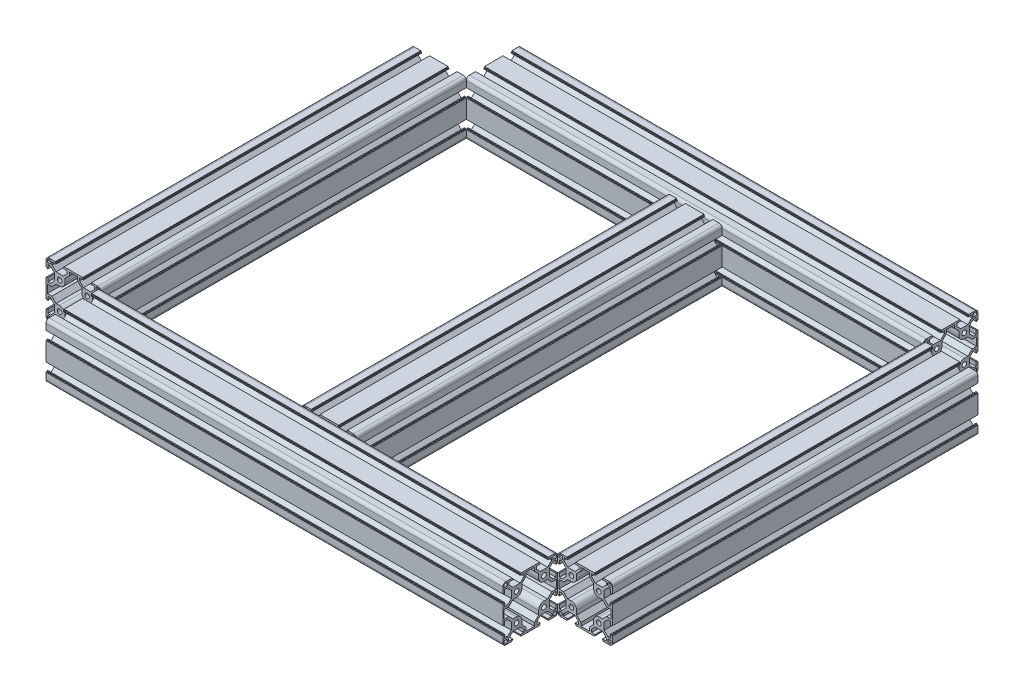
from build123d import *

# Parameters (mm, degrees)
SKETCH_110_R              = 2.55
MEMBER_6060_1_DEPTH       = 400
SKETCH_110_ON_SEGMENT_2_R = 2.55
MEMBER_6060_1_2_DEPTH     = 500
SKETCH_110_ON_SEGMENT_3_R = 2.55
MEMBER_6060_1_3_DEPTH     = 400
SKETCH_110_ON_SEGMENT_4_R = 2.55
MEMBER_6060_1_4_DEPTH     = 500
SKETCH_111_R              = 2.55
MEMBER_6060_2_DEPTH       = 400


with BuildPart() as part:
    # 草图110 → Member 6060_ _1 (new body)
    with BuildSketch(Plane(origin=(-290.754385539, 0, -90.215620869), x_dir=(1, 0, 0), z_dir=(0, 0, 1))):
        with BuildLine():
            Line((10.9, -29), (10.15, -29))
            Line((10.15, -29), (10.15, -30))
            Line((10.15, -30), (-10.15, -30))
            Line((-10.15, -30), (-10.15, -29))
            Line((-10.15, -29), (-10.9, -29))
            Line((-10.9, -29), (-10.9, -28))
            Line((-10.9, -28), (-7.1, -28))
            Line((-7.1, -28), (-7.1, -24.787919242))
            Line((-7.1, -24.787919242), (-11.047762009, -20.8125))
            Line((-11.047762009, -20.8125), (-15, -20.8125))
            Line((-15, -20.8125), (-18.952237991, -20.8125))
            Line((-18.952237991, -20.8125), (-23.6, -25.492823302))
            Line((-23.6, -25.492823302), (-23.6, -28))
            Line((-23.6, -28), (-19.1, -28))
            Line((-19.1, -28), (-19.1, -29))
            Line((-19.1, -29), (-19.85, -29))
            Line((-19.85, -29), (-19.85, -30))
            Line((-19.85, -30), (-26.625, -30))
            ThreePointArc((-26.625, -30), (-29.011485387, -29.011485387), (-30, -26.625))
            Line((-30, -26.625), (-30, -19.85))
            Line((-30, -19.85), (-29, -19.85))
            Line((-29, -19.85), (-29, -19.1))
            Line((-29, -19.1), (-28, -19.1))
            Line((-28, -19.1), (-28, -23.25))
            Line((-28, -23.25), (-25.140371272, -23.25))
            Line((-25.140371272, -23.25), (-20.8125, -18.952237991))
            Line((-20.8125, -18.952237991), (-20.8125, -15))
            Line((-20.8125, -15), (-20.8125, -11.047762009))
            Line((-20.8125, -11.047762009), (-25.140371272, -6.75))
            Line((-25.140371272, -6.75), (-28, -6.75))
            Line((-28, -6.75), (-28, -10.9))
            Line((-28, -10.9), (-29, -10.9))
            Line((-29, -10.9), (-29, -10.15))
            Line((-29, -10.15), (-30, -10.15))
            Line((-30, -10.15), (-30, 10.15))
            Line((-30, 10.15), (-29, 10.15))
            Line((-29, 10.15), (-29, 10.9))
            Line((-29, 10.9), (-28, 10.9))
            Line((-28, 10.9), (-28, 6.75))
            Line((-28, 6.75), (-25.140371272, 6.75))
            Line((-25.140371272, 6.75), (-20.8125, 11.047762009))
            Line((-20.8125, 11.047762009), (-20.8125, 15))
            Line((-20.8125, 15), (-20.8125, 18.952237991))
            Line((-20.8125, 18.952237991), (-25.140371272, 23.25))
            Line((-25.140371272, 23.25), (-28, 23.25))
            Line((-28, 23.25), (-28, 19.1))
            Line((-28, 19.1), (-29, 19.1))
            Line((-29, 19.1), (-29, 19.85))
            Line((-29, 19.85), (-30, 19.85))
            Line((-30, 19.85), (-30, 26.625))
            ThreePointArc((-30, 26.625), (-29.011485387, 29.011485387), (-26.625, 30))
            Line((-26.625, 30), (-19.85, 30))
            Line((-19.85, 30), (-19.85, 29))
            Line((-19.85, 29), (-19.1, 29))
            Line((-19.1, 29), (-19.1, 28))
            Line((-19.1, 28), (-23.25, 28))
            Line((-23.25, 28), (-23.25, 25.140371272))
            Line((-23.25, 25.140371272), (-18.952237991, 20.8125))
            Line((-18.952237991, 20.8125), (-15, 20.8125))
            Line((-15, 20.8125), (-11.047762009, 20.8125))
            Line((-11.047762009, 20.8125), (-6.75, 25.140371272))
            Line((-6.75, 25.140371272), (-6.75, 28))
            Line((-6.75, 28), (-10.9, 28))
            Line((-10.9, 28), (-10.9, 29))
            Line((-10.9, 29), (-10.15, 29))
            Line((-10.15, 29), (-10.15, 30))
            Line((-10.15, 30), (10.15, 30))
            Line((10.15, 30), (10.15, 29))
            Line((10.15, 29), (10.9, 29))
            Line((10.9, 29), (10.9, 28))
            Line((10.9, 28), (6.75, 28))
            Line((6.75, 28), (6.75, 25.140371272))
            Line((6.75, 25.140371272), (11.047762009, 20.8125))
            Line((11.047762009, 20.8125), (15, 20.8125))
            Line((15, 20.8125), (18.952237991, 20.8125))
            Line((18.952237991, 20.8125), (23.25, 25.140371272))
            Line((23.25, 25.140371272), (23.25, 28))
            Line((23.25, 28), (19.1, 28))
            Line((19.1, 28), (19.1, 29))
            Line((19.1, 29), (19.85, 29))
            Line((19.85, 29), (19.85, 30))
            Line((19.85, 30), (26.625, 30))
            ThreePointArc((26.625, 30), (29.011485387, 29.011485387), (30, 26.625))
            Line((30, 26.625), (30, 19.85))
            Line((30, 19.85), (29, 19.85))
            Line((29, 19.85), (29, 19.1))
            Line((29, 19.1), (28, 19.1))
            Line((28, 19.1), (28, 23.25))
            Line((28, 23.25), (25.140371272, 23.25))
            Line((25.140371272, 23.25), (20.8125, 18.952237991))
            Line((20.8125, 18.952237991), (20.8125, 15))
            Line((20.8125, 15), (20.8125, 11.047762009))
            Line((20.8125, 11.047762009), (25.140371272, 6.75))
            Line((25.140371272, 6.75), (28, 6.75))
            Line((28, 6.75), (28, 10.9))
            Line((28, 10.9), (29, 10.9))
            Line((29, 10.9), (29, 10.15))
            Line((29, 10.15), (30, 10.15))
            Line((30, 10.15), (30, -10.15))
            Line((30, -10.15), (29, -10.15))
            Line((29, -10.15), (29, -10.9))
            Line((29, -10.9), (28, -10.9))
            Line((28, -10.9), (28, -6.75))
            Line((28, -6.75), (25.140371272, -6.75))
            Line((25.140371272, -6.75), (20.8125, -11.047762009))
            Line((20.8125, -11.047762009), (20.8125, -15))
            Line((20.8125, -15), (20.8125, -18.952237991))
            Line((20.8125, -18.952237991), (25.140371272, -23.25))
            Line((25.140371272, -23.25), (28, -23.25))
            Line((28, -23.25), (28, -19.1))
            Line((28, -19.1), (29, -19.1))
            Line((29, -19.1), (29, -19.85))
            Line((29, -19.85), (30, -19.85))
            Line((30, -19.85), (30, -26.625))
            ThreePointArc((30, -26.625), (29.011485387, -29.011485387), (26.625, -30))
            Line((26.625, -30), (19.85, -30))
            Line((19.85, -30), (19.85, -29))
            Line((19.85, -29), (19.1, -29))
            Line((19.1, -29), (19.1, -28))
            Line((19.1, -28), (23.6, -28))
            Line((23.6, -28), (23.6, -25.492823302))
            Line((23.6, -25.492823302), (18.952237991, -20.8125))
            Line((18.952237991, -20.8125), (15, -20.8125))
            Line((15, -20.8125), (11.047762009, -20.8125))
            Line((11.047762009, -20.8125), (7.1, -24.787919242))
            Line((7.1, -24.787919242), (7.1, -28))
            Line((7.1, -28), (10.9, -28))
            Line((10.9, -28), (10.9, -29))
        make_face()
        with Locations((-15, 15)):
            Circle(SKETCH_110_R, mode=Mode.SUBTRACT)
        with Locations((-15, -15)):
            Circle(SKETCH_110_R, mode=Mode.SUBTRACT)
        with Locations((15, 15)):
            Circle(SKETCH_110_R, mode=Mode.SUBTRACT)
        with Locations((15, -15)):
            Circle(SKETCH_110_R, mode=Mode.SUBTRACT)
        with BuildLine():
            Line((-9.1875, 15.1875), (-9.1875, 19.563607307))
            Line((-9.1875, 19.563607307), (-4.55, 24.233596706))
            Line((-4.55, 24.233596706), (-4.55, 28))
            Line((-4.55, 28), (4.55, 28))
            Line((4.55, 28), (4.55, 24.233596706))
            Line((4.55, 24.233596706), (9.1875, 19.563607307))
            Line((9.1875, 19.563607307), (9.1875, 15.1875))
            ThreePointArc((9.1875, 15.1875), (10.944859313, 10.944859313), (15.1875, 9.1875))
            Line((15.1875, 9.1875), (18.952237991, 9.1875))
            Line((18.952237991, 9.1875), (23.557474622, 4.55))
            Line((23.557474622, 4.55), (28.5, 4.55))
            Line((28.5, 4.55), (28.5, -4.55))
            Line((28.5, -4.55), (23.557474622, -4.55))
            Line((23.557474622, -4.55), (18.952237991, -9.1875))
            Line((18.952237991, -9.1875), (15.1875, -9.1875))
            ThreePointArc((15.1875, -9.1875), (10.944859313, -10.944859313), (9.1875, -15.1875))
            Line((9.1875, -15.1875), (9.1875, -19.563607307))
            Line((9.1875, -19.563607307), (4.55, -24.233596706))
            Line((4.55, -24.233596706), (4.55, -28))
            Line((4.55, -28), (-4.55, -28))
            Line((-4.55, -28), (-4.55, -24.233596706))
            Line((-4.55, -24.233596706), (-9.1875, -19.563607307))
            Line((-9.1875, -19.563607307), (-9.1875, -15.1875))
            ThreePointArc((-9.1875, -15.1875), (-10.944859313, -10.944859313), (-15.1875, -9.1875))
            Line((-15.1875, -9.1875), (-18.952237991, -9.1875))
            Line((-18.952237991, -9.1875), (-23.557474622, -4.55))
            Line((-23.557474622, -4.55), (-28.5, -4.55))
            Line((-28.5, -4.55), (-28.5, 4.55))
            Line((-28.5, 4.55), (-23.557474622, 4.55))
            Line((-23.557474622, 4.55), (-18.952237991, 9.1875))
            Line((-18.952237991, 9.1875), (-15.1875, 9.1875))
            ThreePointArc((-15.1875, 9.1875), (-10.944859313, 10.944859313), (-9.1875, 15.1875))
        make_face(mode=Mode.SUBTRACT)
        with BuildLine():
            Line((-25.75, 28.6), (-27.6, 28.6))
            ThreePointArc((-27.6, 28.6), (-28.307106781, 28.307106781), (-28.6, 27.6))
            Line((-28.6, 27.6), (-28.6, 26))
            ThreePointArc((-28.6, 26), (-28.307106781, 25.292893219), (-27.6, 25))
            Line((-27.6, 25), (-25.75, 25))
            ThreePointArc((-25.75, 25), (-25.042893219, 25.292893219), (-24.75, 26))
            Line((-24.75, 26), (-24.75, 27.6))
            ThreePointArc((-24.75, 27.6), (-25.042893219, 28.307106781), (-25.75, 28.6))
        make_face(mode=Mode.SUBTRACT)
        with BuildLine():
            Line((-26, -28.6), (-27.6, -28.6))
            ThreePointArc((-27.6, -28.6), (-28.307106781, -28.307106781), (-28.6, -27.6))
            Line((-28.6, -27.6), (-28.6, -26))
            ThreePointArc((-28.6, -26), (-28.307106781, -25.292893219), (-27.6, -25))
            Line((-27.6, -25), (-26, -25))
            ThreePointArc((-26, -25), (-25.292893219, -25.292893219), (-25, -26))
            Line((-25, -26), (-25, -27.6))
            ThreePointArc((-25, -27.6), (-25.292893219, -28.307106781), (-26, -28.6))
        make_face(mode=Mode.SUBTRACT)
        with BuildLine():
            Line((26, -28.6), (27.6, -28.6))
            ThreePointArc((27.6, -28.6), (28.307106781, -28.307106781), (28.6, -27.6))
            Line((28.6, -27.6), (28.6, -26))
            ThreePointArc((28.6, -26), (28.307106781, -25.292893219), (27.6, -25))
            Line((27.6, -25), (26, -25))
            ThreePointArc((26, -25), (25.292893219, -25.292893219), (25, -26))
            Line((25, -26), (25, -27.6))
            ThreePointArc((25, -27.6), (25.292893219, -28.307106781), (26, -28.6))
        make_face(mode=Mode.SUBTRACT)
        with BuildLine():
            Line((25.75, 28.6), (27.6, 28.6))
            ThreePointArc((27.6, 28.6), (28.307106781, 28.307106781), (28.6, 27.6))
            Line((28.6, 27.6), (28.6, 26))
            ThreePointArc((28.6, 26), (28.307106781, 25.292893219), (27.6, 25))
            Line((27.6, 25), (25.75, 25))
            ThreePointArc((25.75, 25), (25.042893219, 25.292893219), (24.75, 26))
            Line((24.75, 26), (24.75, 27.6))
            ThreePointArc((24.75, 27.6), (25.042893219, 28.307106781), (25.75, 28.6))
        make_face(mode=Mode.SUBTRACT)
    extrude(amount=MEMBER_6060_1_DEPTH)


with BuildPart() as body_2:
    # 草图110 on segment 2 (carried to segment 2) → Member 6060_ _1 2 (new body)
    with BuildSketch(Plane(origin=(-260.754385539, 0, 339.784379131), x_dir=(0, 0, -1), z_dir=(1, 0, 0))):
        with BuildLine():
            Line((10.9, -29), (10.15, -29))
            Line((10.15, -29), (10.15, -30))
            Line((10.15, -30), (-10.15, -30))
            Line((-10.15, -30), (-10.15, -29))
            Line((-10.15, -29), (-10.9, -29))
            Line((-10.9, -29), (-10.9, -28))
            Line((-10.9, -28), (-7.1, -28))
            Line((-7.1, -28), (-7.1, -24.787919242))
            Line((-7.1, -24.787919242), (-11.047762009, -20.8125))
            Line((-11.047762009, -20.8125), (-15, -20.8125))
            Line((-15, -20.8125), (-18.952237991, -20.8125))
            Line((-18.952237991, -20.8125), (-23.6, -25.492823302))
            Line((-23.6, -25.492823302), (-23.6, -28))
            Line((-23.6, -28), (-19.1, -28))
            Line((-19.1, -28), (-19.1, -29))
            Line((-19.1, -29), (-19.85, -29))
            Line((-19.85, -29), (-19.85, -30))
            Line((-19.85, -30), (-26.625, -30))
            ThreePointArc((-26.625, -30), (-29.011485387, -29.011485387), (-30, -26.625))
            Line((-30, -26.625), (-30, -19.85))
            Line((-30, -19.85), (-29, -19.85))
            Line((-29, -19.85), (-29, -19.1))
            Line((-29, -19.1), (-28, -19.1))
            Line((-28, -19.1), (-28, -23.25))
            Line((-28, -23.25), (-25.140371272, -23.25))
            Line((-25.140371272, -23.25), (-20.8125, -18.952237991))
            Line((-20.8125, -18.952237991), (-20.8125, -15))
            Line((-20.8125, -15), (-20.8125, -11.047762009))
            Line((-20.8125, -11.047762009), (-25.140371272, -6.75))
            Line((-25.140371272, -6.75), (-28, -6.75))
            Line((-28, -6.75), (-28, -10.9))
            Line((-28, -10.9), (-29, -10.9))
            Line((-29, -10.9), (-29, -10.15))
            Line((-29, -10.15), (-30, -10.15))
            Line((-30, -10.15), (-30, 10.15))
            Line((-30, 10.15), (-29, 10.15))
            Line((-29, 10.15), (-29, 10.9))
            Line((-29, 10.9), (-28, 10.9))
            Line((-28, 10.9), (-28, 6.75))
            Line((-28, 6.75), (-25.140371272, 6.75))
            Line((-25.140371272, 6.75), (-20.8125, 11.047762009))
            Line((-20.8125, 11.047762009), (-20.8125, 15))
            Line((-20.8125, 15), (-20.8125, 18.952237991))
            Line((-20.8125, 18.952237991), (-25.140371272, 23.25))
            Line((-25.140371272, 23.25), (-28, 23.25))
            Line((-28, 23.25), (-28, 19.1))
            Line((-28, 19.1), (-29, 19.1))
            Line((-29, 19.1), (-29, 19.85))
            Line((-29, 19.85), (-30, 19.85))
            Line((-30, 19.85), (-30, 26.625))
            ThreePointArc((-30, 26.625), (-29.011485387, 29.011485387), (-26.625, 30))
            Line((-26.625, 30), (-19.85, 30))
            Line((-19.85, 30), (-19.85, 29))
            Line((-19.85, 29), (-19.1, 29))
            Line((-19.1, 29), (-19.1, 28))
            Line((-19.1, 28), (-23.25, 28))
            Line((-23.25, 28), (-23.25, 25.140371272))
            Line((-23.25, 25.140371272), (-18.952237991, 20.8125))
            Line((-18.952237991, 20.8125), (-15, 20.8125))
            Line((-15, 20.8125), (-11.047762009, 20.8125))
            Line((-11.047762009, 20.8125), (-6.75, 25.140371272))
            Line((-6.75, 25.140371272), (-6.75, 28))
            Line((-6.75, 28), (-10.9, 28))
            Line((-10.9, 28), (-10.9, 29))
            Line((-10.9, 29), (-10.15, 29))
            Line((-10.15, 29), (-10.15, 30))
            Line((-10.15, 30), (10.15, 30))
            Line((10.15, 30), (10.15, 29))
            Line((10.15, 29), (10.9, 29))
            Line((10.9, 29), (10.9, 28))
            Line((10.9, 28), (6.75, 28))
            Line((6.75, 28), (6.75, 25.140371272))
            Line((6.75, 25.140371272), (11.047762009, 20.8125))
            Line((11.047762009, 20.8125), (15, 20.8125))
            Line((15, 20.8125), (18.952237991, 20.8125))
            Line((18.952237991, 20.8125), (23.25, 25.140371272))
            Line((23.25, 25.140371272), (23.25, 28))
            Line((23.25, 28), (19.1, 28))
            Line((19.1, 28), (19.1, 29))
            Line((19.1, 29), (19.85, 29))
            Line((19.85, 29), (19.85, 30))
            Line((19.85, 30), (26.625, 30))
            ThreePointArc((26.625, 30), (29.011485387, 29.011485387), (30, 26.625))
            Line((30, 26.625), (30, 19.85))
            Line((30, 19.85), (29, 19.85))
            Line((29, 19.85), (29, 19.1))
            Line((29, 19.1), (28, 19.1))
            Line((28, 19.1), (28, 23.25))
            Line((28, 23.25), (25.140371272, 23.25))
            Line((25.140371272, 23.25), (20.8125, 18.952237991))
            Line((20.8125, 18.952237991), (20.8125, 15))
            Line((20.8125, 15), (20.8125, 11.047762009))
            Line((20.8125, 11.047762009), (25.140371272, 6.75))
            Line((25.140371272, 6.75), (28, 6.75))
            Line((28, 6.75), (28, 10.9))
            Line((28, 10.9), (29, 10.9))
            Line((29, 10.9), (29, 10.15))
            Line((29, 10.15), (30, 10.15))
            Line((30, 10.15), (30, -10.15))
            Line((30, -10.15), (29, -10.15))
            Line((29, -10.15), (29, -10.9))
            Line((29, -10.9), (28, -10.9))
            Line((28, -10.9), (28, -6.75))
            Line((28, -6.75), (25.140371272, -6.75))
            Line((25.140371272, -6.75), (20.8125, -11.047762009))
            Line((20.8125, -11.047762009), (20.8125, -15))
            Line((20.8125, -15), (20.8125, -18.952237991))
            Line((20.8125, -18.952237991), (25.140371272, -23.25))
            Line((25.140371272, -23.25), (28, -23.25))
            Line((28, -23.25), (28, -19.1))
            Line((28, -19.1), (29, -19.1))
            Line((29, -19.1), (29, -19.85))
            Line((29, -19.85), (30, -19.85))
            Line((30, -19.85), (30, -26.625))
            ThreePointArc((30, -26.625), (29.011485387, -29.011485387), (26.625, -30))
            Line((26.625, -30), (19.85, -30))
            Line((19.85, -30), (19.85, -29))
            Line((19.85, -29), (19.1, -29))
            Line((19.1, -29), (19.1, -28))
            Line((19.1, -28), (23.6, -28))
            Line((23.6, -28), (23.6, -25.492823302))
            Line((23.6, -25.492823302), (18.952237991, -20.8125))
            Line((18.952237991, -20.8125), (15, -20.8125))
            Line((15, -20.8125), (11.047762009, -20.8125))
            Line((11.047762009, -20.8125), (7.1, -24.787919242))
            Line((7.1, -24.787919242), (7.1, -28))
            Line((7.1, -28), (10.9, -28))
            Line((10.9, -28), (10.9, -29))
        make_face()
        with Locations((-15, 15)):
            Circle(SKETCH_110_ON_SEGMENT_2_R, mode=Mode.SUBTRACT)
        with Locations((-15, -15)):
            Circle(SKETCH_110_ON_SEGMENT_2_R, mode=Mode.SUBTRACT)
        with Locations((15, 15)):
            Circle(SKETCH_110_ON_SEGMENT_2_R, mode=Mode.SUBTRACT)
        with Locations((15, -15)):
            Circle(SKETCH_110_ON_SEGMENT_2_R, mode=Mode.SUBTRACT)
        with BuildLine():
            Line((-9.1875, 15.1875), (-9.1875, 19.563607307))
            Line((-9.1875, 19.563607307), (-4.55, 24.233596706))
            Line((-4.55, 24.233596706), (-4.55, 28))
            Line((-4.55, 28), (4.55, 28))
            Line((4.55, 28), (4.55, 24.233596706))
            Line((4.55, 24.233596706), (9.1875, 19.563607307))
            Line((9.1875, 19.563607307), (9.1875, 15.1875))
            ThreePointArc((9.1875, 15.1875), (10.944859313, 10.944859313), (15.1875, 9.1875))
            Line((15.1875, 9.1875), (18.952237991, 9.1875))
            Line((18.952237991, 9.1875), (23.557474622, 4.55))
            Line((23.557474622, 4.55), (28.5, 4.55))
            Line((28.5, 4.55), (28.5, -4.55))
            Line((28.5, -4.55), (23.557474622, -4.55))
            Line((23.557474622, -4.55), (18.952237991, -9.1875))
            Line((18.952237991, -9.1875), (15.1875, -9.1875))
            ThreePointArc((15.1875, -9.1875), (10.944859313, -10.944859313), (9.1875, -15.1875))
            Line((9.1875, -15.1875), (9.1875, -19.563607307))
            Line((9.1875, -19.563607307), (4.55, -24.233596706))
            Line((4.55, -24.233596706), (4.55, -28))
            Line((4.55, -28), (-4.55, -28))
            Line((-4.55, -28), (-4.55, -24.233596706))
            Line((-4.55, -24.233596706), (-9.1875, -19.563607307))
            Line((-9.1875, -19.563607307), (-9.1875, -15.1875))
            ThreePointArc((-9.1875, -15.1875), (-10.944859313, -10.944859313), (-15.1875, -9.1875))
            Line((-15.1875, -9.1875), (-18.952237991, -9.1875))
            Line((-18.952237991, -9.1875), (-23.557474622, -4.55))
            Line((-23.557474622, -4.55), (-28.5, -4.55))
            Line((-28.5, -4.55), (-28.5, 4.55))
            Line((-28.5, 4.55), (-23.557474622, 4.55))
            Line((-23.557474622, 4.55), (-18.952237991, 9.1875))
            Line((-18.952237991, 9.1875), (-15.1875, 9.1875))
            ThreePointArc((-15.1875, 9.1875), (-10.944859313, 10.944859313), (-9.1875, 15.1875))
        make_face(mode=Mode.SUBTRACT)
        with BuildLine():
            Line((-25.75, 28.6), (-27.6, 28.6))
            ThreePointArc((-27.6, 28.6), (-28.307106781, 28.307106781), (-28.6, 27.6))
            Line((-28.6, 27.6), (-28.6, 26))
            ThreePointArc((-28.6, 26), (-28.307106781, 25.292893219), (-27.6, 25))
            Line((-27.6, 25), (-25.75, 25))
            ThreePointArc((-25.75, 25), (-25.042893219, 25.292893219), (-24.75, 26))
            Line((-24.75, 26), (-24.75, 27.6))
            ThreePointArc((-24.75, 27.6), (-25.042893219, 28.307106781), (-25.75, 28.6))
        make_face(mode=Mode.SUBTRACT)
        with BuildLine():
            Line((-26, -28.6), (-27.6, -28.6))
            ThreePointArc((-27.6, -28.6), (-28.307106781, -28.307106781), (-28.6, -27.6))
            Line((-28.6, -27.6), (-28.6, -26))
            ThreePointArc((-28.6, -26), (-28.307106781, -25.292893219), (-27.6, -25))
            Line((-27.6, -25), (-26, -25))
            ThreePointArc((-26, -25), (-25.292893219, -25.292893219), (-25, -26))
            Line((-25, -26), (-25, -27.6))
            ThreePointArc((-25, -27.6), (-25.292893219, -28.307106781), (-26, -28.6))
        make_face(mode=Mode.SUBTRACT)
        with BuildLine():
            Line((26, -28.6), (27.6, -28.6))
            ThreePointArc((27.6, -28.6), (28.307106781, -28.307106781), (28.6, -27.6))
            Line((28.6, -27.6), (28.6, -26))
            ThreePointArc((28.6, -26), (28.307106781, -25.292893219), (27.6, -25))
            Line((27.6, -25), (26, -25))
            ThreePointArc((26, -25), (25.292893219, -25.292893219), (25, -26))
            Line((25, -26), (25, -27.6))
            ThreePointArc((25, -27.6), (25.292893219, -28.307106781), (26, -28.6))
        make_face(mode=Mode.SUBTRACT)
        with BuildLine():
            Line((25.75, 28.6), (27.6, 28.6))
            ThreePointArc((27.6, 28.6), (28.307106781, 28.307106781), (28.6, 27.6))
            Line((28.6, 27.6), (28.6, 26))
            ThreePointArc((28.6, 26), (28.307106781, 25.292893219), (27.6, 25))
            Line((27.6, 25), (25.75, 25))
            ThreePointArc((25.75, 25), (25.042893219, 25.292893219), (24.75, 26))
            Line((24.75, 26), (24.75, 27.6))
            ThreePointArc((24.75, 27.6), (25.042893219, 28.307106781), (25.75, 28.6))
        make_face(mode=Mode.SUBTRACT)
    extrude(amount=MEMBER_6060_1_2_DEPTH)


with BuildPart() as body_3:
    # 草图110 on segment 3 (carried to segment 3) → Member 6060_ _1 3 (new body)
    with BuildSketch(Plane(origin=(269.245614461, 0, -90.215620869), x_dir=(1, 0, 0), z_dir=(0, 0, 1))):
        with BuildLine():
            Line((10.9, -29), (10.15, -29))
            Line((10.15, -29), (10.15, -30))
            Line((10.15, -30), (-10.15, -30))
            Line((-10.15, -30), (-10.15, -29))
            Line((-10.15, -29), (-10.9, -29))
            Line((-10.9, -29), (-10.9, -28))
            Line((-10.9, -28), (-7.1, -28))
            Line((-7.1, -28), (-7.1, -24.787919242))
            Line((-7.1, -24.787919242), (-11.047762009, -20.8125))
            Line((-11.047762009, -20.8125), (-15, -20.8125))
            Line((-15, -20.8125), (-18.952237991, -20.8125))
            Line((-18.952237991, -20.8125), (-23.6, -25.492823302))
            Line((-23.6, -25.492823302), (-23.6, -28))
            Line((-23.6, -28), (-19.1, -28))
            Line((-19.1, -28), (-19.1, -29))
            Line((-19.1, -29), (-19.85, -29))
            Line((-19.85, -29), (-19.85, -30))
            Line((-19.85, -30), (-26.625, -30))
            ThreePointArc((-26.625, -30), (-29.011485387, -29.011485387), (-30, -26.625))
            Line((-30, -26.625), (-30, -19.85))
            Line((-30, -19.85), (-29, -19.85))
            Line((-29, -19.85), (-29, -19.1))
            Line((-29, -19.1), (-28, -19.1))
            Line((-28, -19.1), (-28, -23.25))
            Line((-28, -23.25), (-25.140371272, -23.25))
            Line((-25.140371272, -23.25), (-20.8125, -18.952237991))
            Line((-20.8125, -18.952237991), (-20.8125, -15))
            Line((-20.8125, -15), (-20.8125, -11.047762009))
            Line((-20.8125, -11.047762009), (-25.140371272, -6.75))
            Line((-25.140371272, -6.75), (-28, -6.75))
            Line((-28, -6.75), (-28, -10.9))
            Line((-28, -10.9), (-29, -10.9))
            Line((-29, -10.9), (-29, -10.15))
            Line((-29, -10.15), (-30, -10.15))
            Line((-30, -10.15), (-30, 10.15))
            Line((-30, 10.15), (-29, 10.15))
            Line((-29, 10.15), (-29, 10.9))
            Line((-29, 10.9), (-28, 10.9))
            Line((-28, 10.9), (-28, 6.75))
            Line((-28, 6.75), (-25.140371272, 6.75))
            Line((-25.140371272, 6.75), (-20.8125, 11.047762009))
            Line((-20.8125, 11.047762009), (-20.8125, 15))
            Line((-20.8125, 15), (-20.8125, 18.952237991))
            Line((-20.8125, 18.952237991), (-25.140371272, 23.25))
            Line((-25.140371272, 23.25), (-28, 23.25))
            Line((-28, 23.25), (-28, 19.1))
            Line((-28, 19.1), (-29, 19.1))
            Line((-29, 19.1), (-29, 19.85))
            Line((-29, 19.85), (-30, 19.85))
            Line((-30, 19.85), (-30, 26.625))
            ThreePointArc((-30, 26.625), (-29.011485387, 29.011485387), (-26.625, 30))
            Line((-26.625, 30), (-19.85, 30))
            Line((-19.85, 30), (-19.85, 29))
            Line((-19.85, 29), (-19.1, 29))
            Line((-19.1, 29), (-19.1, 28))
            Line((-19.1, 28), (-23.25, 28))
            Line((-23.25, 28), (-23.25, 25.140371272))
            Line((-23.25, 25.140371272), (-18.952237991, 20.8125))
            Line((-18.952237991, 20.8125), (-15, 20.8125))
            Line((-15, 20.8125), (-11.047762009, 20.8125))
            Line((-11.047762009, 20.8125), (-6.75, 25.140371272))
            Line((-6.75, 25.140371272), (-6.75, 28))
            Line((-6.75, 28), (-10.9, 28))
            Line((-10.9, 28), (-10.9, 29))
            Line((-10.9, 29), (-10.15, 29))
            Line((-10.15, 29), (-10.15, 30))
            Line((-10.15, 30), (10.15, 30))
            Line((10.15, 30), (10.15, 29))
            Line((10.15, 29), (10.9, 29))
            Line((10.9, 29), (10.9, 28))
            Line((10.9, 28), (6.75, 28))
            Line((6.75, 28), (6.75, 25.140371272))
            Line((6.75, 25.140371272), (11.047762009, 20.8125))
            Line((11.047762009, 20.8125), (15, 20.8125))
            Line((15, 20.8125), (18.952237991, 20.8125))
            Line((18.952237991, 20.8125), (23.25, 25.140371272))
            Line((23.25, 25.140371272), (23.25, 28))
            Line((23.25, 28), (19.1, 28))
            Line((19.1, 28), (19.1, 29))
            Line((19.1, 29), (19.85, 29))
            Line((19.85, 29), (19.85, 30))
            Line((19.85, 30), (26.625, 30))
            ThreePointArc((26.625, 30), (29.011485387, 29.011485387), (30, 26.625))
            Line((30, 26.625), (30, 19.85))
            Line((30, 19.85), (29, 19.85))
            Line((29, 19.85), (29, 19.1))
            Line((29, 19.1), (28, 19.1))
            Line((28, 19.1), (28, 23.25))
            Line((28, 23.25), (25.140371272, 23.25))
            Line((25.140371272, 23.25), (20.8125, 18.952237991))
            Line((20.8125, 18.952237991), (20.8125, 15))
            Line((20.8125, 15), (20.8125, 11.047762009))
            Line((20.8125, 11.047762009), (25.140371272, 6.75))
            Line((25.140371272, 6.75), (28, 6.75))
            Line((28, 6.75), (28, 10.9))
            Line((28, 10.9), (29, 10.9))
            Line((29, 10.9), (29, 10.15))
            Line((29, 10.15), (30, 10.15))
            Line((30, 10.15), (30, -10.15))
            Line((30, -10.15), (29, -10.15))
            Line((29, -10.15), (29, -10.9))
            Line((29, -10.9), (28, -10.9))
            Line((28, -10.9), (28, -6.75))
            Line((28, -6.75), (25.140371272, -6.75))
            Line((25.140371272, -6.75), (20.8125, -11.047762009))
            Line((20.8125, -11.047762009), (20.8125, -15))
            Line((20.8125, -15), (20.8125, -18.952237991))
            Line((20.8125, -18.952237991), (25.140371272, -23.25))
            Line((25.140371272, -23.25), (28, -23.25))
            Line((28, -23.25), (28, -19.1))
            Line((28, -19.1), (29, -19.1))
            Line((29, -19.1), (29, -19.85))
            Line((29, -19.85), (30, -19.85))
            Line((30, -19.85), (30, -26.625))
            ThreePointArc((30, -26.625), (29.011485387, -29.011485387), (26.625, -30))
            Line((26.625, -30), (19.85, -30))
            Line((19.85, -30), (19.85, -29))
            Line((19.85, -29), (19.1, -29))
            Line((19.1, -29), (19.1, -28))
            Line((19.1, -28), (23.6, -28))
            Line((23.6, -28), (23.6, -25.492823302))
            Line((23.6, -25.492823302), (18.952237991, -20.8125))
            Line((18.952237991, -20.8125), (15, -20.8125))
            Line((15, -20.8125), (11.047762009, -20.8125))
            Line((11.047762009, -20.8125), (7.1, -24.787919242))
            Line((7.1, -24.787919242), (7.1, -28))
            Line((7.1, -28), (10.9, -28))
            Line((10.9, -28), (10.9, -29))
        make_face()
        with Locations((-15, 15)):
            Circle(SKETCH_110_ON_SEGMENT_3_R, mode=Mode.SUBTRACT)
        with Locations((-15, -15)):
            Circle(SKETCH_110_ON_SEGMENT_3_R, mode=Mode.SUBTRACT)
        with Locations((15, 15)):
            Circle(SKETCH_110_ON_SEGMENT_3_R, mode=Mode.SUBTRACT)
        with Locations((15, -15)):
            Circle(SKETCH_110_ON_SEGMENT_3_R, mode=Mode.SUBTRACT)
        with BuildLine():
            Line((-9.1875, 15.1875), (-9.1875, 19.563607307))
            Line((-9.1875, 19.563607307), (-4.55, 24.233596706))
            Line((-4.55, 24.233596706), (-4.55, 28))
            Line((-4.55, 28), (4.55, 28))
            Line((4.55, 28), (4.55, 24.233596706))
            Line((4.55, 24.233596706), (9.1875, 19.563607307))
            Line((9.1875, 19.563607307), (9.1875, 15.1875))
            ThreePointArc((9.1875, 15.1875), (10.944859313, 10.944859313), (15.1875, 9.1875))
            Line((15.1875, 9.1875), (18.952237991, 9.1875))
            Line((18.952237991, 9.1875), (23.557474622, 4.55))
            Line((23.557474622, 4.55), (28.5, 4.55))
            Line((28.5, 4.55), (28.5, -4.55))
            Line((28.5, -4.55), (23.557474622, -4.55))
            Line((23.557474622, -4.55), (18.952237991, -9.1875))
            Line((18.952237991, -9.1875), (15.1875, -9.1875))
            ThreePointArc((15.1875, -9.1875), (10.944859313, -10.944859313), (9.1875, -15.1875))
            Line((9.1875, -15.1875), (9.1875, -19.563607307))
            Line((9.1875, -19.563607307), (4.55, -24.233596706))
            Line((4.55, -24.233596706), (4.55, -28))
            Line((4.55, -28), (-4.55, -28))
            Line((-4.55, -28), (-4.55, -24.233596706))
            Line((-4.55, -24.233596706), (-9.1875, -19.563607307))
            Line((-9.1875, -19.563607307), (-9.1875, -15.1875))
            ThreePointArc((-9.1875, -15.1875), (-10.944859313, -10.944859313), (-15.1875, -9.1875))
            Line((-15.1875, -9.1875), (-18.952237991, -9.1875))
            Line((-18.952237991, -9.1875), (-23.557474622, -4.55))
            Line((-23.557474622, -4.55), (-28.5, -4.55))
            Line((-28.5, -4.55), (-28.5, 4.55))
            Line((-28.5, 4.55), (-23.557474622, 4.55))
            Line((-23.557474622, 4.55), (-18.952237991, 9.1875))
            Line((-18.952237991, 9.1875), (-15.1875, 9.1875))
            ThreePointArc((-15.1875, 9.1875), (-10.944859313, 10.944859313), (-9.1875, 15.1875))
        make_face(mode=Mode.SUBTRACT)
        with BuildLine():
            Line((-25.75, 28.6), (-27.6, 28.6))
            ThreePointArc((-27.6, 28.6), (-28.307106781, 28.307106781), (-28.6, 27.6))
            Line((-28.6, 27.6), (-28.6, 26))
            ThreePointArc((-28.6, 26), (-28.307106781, 25.292893219), (-27.6, 25))
            Line((-27.6, 25), (-25.75, 25))
            ThreePointArc((-25.75, 25), (-25.042893219, 25.292893219), (-24.75, 26))
            Line((-24.75, 26), (-24.75, 27.6))
            ThreePointArc((-24.75, 27.6), (-25.042893219, 28.307106781), (-25.75, 28.6))
        make_face(mode=Mode.SUBTRACT)
        with BuildLine():
            Line((-26, -28.6), (-27.6, -28.6))
            ThreePointArc((-27.6, -28.6), (-28.307106781, -28.307106781), (-28.6, -27.6))
            Line((-28.6, -27.6), (-28.6, -26))
            ThreePointArc((-28.6, -26), (-28.307106781, -25.292893219), (-27.6, -25))
            Line((-27.6, -25), (-26, -25))
            ThreePointArc((-26, -25), (-25.292893219, -25.292893219), (-25, -26))
            Line((-25, -26), (-25, -27.6))
            ThreePointArc((-25, -27.6), (-25.292893219, -28.307106781), (-26, -28.6))
        make_face(mode=Mode.SUBTRACT)
        with BuildLine():
            Line((26, -28.6), (27.6, -28.6))
            ThreePointArc((27.6, -28.6), (28.307106781, -28.307106781), (28.6, -27.6))
            Line((28.6, -27.6), (28.6, -26))
            ThreePointArc((28.6, -26), (28.307106781, -25.292893219), (27.6, -25))
            Line((27.6, -25), (26, -25))
            ThreePointArc((26, -25), (25.292893219, -25.292893219), (25, -26))
            Line((25, -26), (25, -27.6))
            ThreePointArc((25, -27.6), (25.292893219, -28.307106781), (26, -28.6))
        make_face(mode=Mode.SUBTRACT)
        with BuildLine():
            Line((25.75, 28.6), (27.6, 28.6))
            ThreePointArc((27.6, 28.6), (28.307106781, 28.307106781), (28.6, 27.6))
            Line((28.6, 27.6), (28.6, 26))
            ThreePointArc((28.6, 26), (28.307106781, 25.292893219), (27.6, 25))
            Line((27.6, 25), (25.75, 25))
            ThreePointArc((25.75, 25), (25.042893219, 25.292893219), (24.75, 26))
            Line((24.75, 26), (24.75, 27.6))
            ThreePointArc((24.75, 27.6), (25.042893219, 28.307106781), (25.75, 28.6))
        make_face(mode=Mode.SUBTRACT)
    extrude(amount=MEMBER_6060_1_3_DEPTH)


with BuildPart() as body_4:
    # 草图110 on segment 4 (carried to segment 4) → Member 6060_ _1 4 (new body)
    with BuildSketch(Plane(origin=(-260.754385539, 0, -120.215620869), x_dir=(0, 0, -1), z_dir=(1, 0, 0))):
        with BuildLine():
            Line((10.9, -29), (10.15, -29))
            Line((10.15, -29), (10.15, -30))
            Line((10.15, -30), (-10.15, -30))
            Line((-10.15, -30), (-10.15, -29))
            Line((-10.15, -29), (-10.9, -29))
            Line((-10.9, -29), (-10.9, -28))
            Line((-10.9, -28), (-7.1, -28))
            Line((-7.1, -28), (-7.1, -24.787919242))
            Line((-7.1, -24.787919242), (-11.047762009, -20.8125))
            Line((-11.047762009, -20.8125), (-15, -20.8125))
            Line((-15, -20.8125), (-18.952237991, -20.8125))
            Line((-18.952237991, -20.8125), (-23.6, -25.492823302))
            Line((-23.6, -25.492823302), (-23.6, -28))
            Line((-23.6, -28), (-19.1, -28))
            Line((-19.1, -28), (-19.1, -29))
            Line((-19.1, -29), (-19.85, -29))
            Line((-19.85, -29), (-19.85, -30))
            Line((-19.85, -30), (-26.625, -30))
            ThreePointArc((-26.625, -30), (-29.011485387, -29.011485387), (-30, -26.625))
            Line((-30, -26.625), (-30, -19.85))
            Line((-30, -19.85), (-29, -19.85))
            Line((-29, -19.85), (-29, -19.1))
            Line((-29, -19.1), (-28, -19.1))
            Line((-28, -19.1), (-28, -23.25))
            Line((-28, -23.25), (-25.140371272, -23.25))
            Line((-25.140371272, -23.25), (-20.8125, -18.952237991))
            Line((-20.8125, -18.952237991), (-20.8125, -15))
            Line((-20.8125, -15), (-20.8125, -11.047762009))
            Line((-20.8125, -11.047762009), (-25.140371272, -6.75))
            Line((-25.140371272, -6.75), (-28, -6.75))
            Line((-28, -6.75), (-28, -10.9))
            Line((-28, -10.9), (-29, -10.9))
            Line((-29, -10.9), (-29, -10.15))
            Line((-29, -10.15), (-30, -10.15))
            Line((-30, -10.15), (-30, 10.15))
            Line((-30, 10.15), (-29, 10.15))
            Line((-29, 10.15), (-29, 10.9))
            Line((-29, 10.9), (-28, 10.9))
            Line((-28, 10.9), (-28, 6.75))
            Line((-28, 6.75), (-25.140371272, 6.75))
            Line((-25.140371272, 6.75), (-20.8125, 11.047762009))
            Line((-20.8125, 11.047762009), (-20.8125, 15))
            Line((-20.8125, 15), (-20.8125, 18.952237991))
            Line((-20.8125, 18.952237991), (-25.140371272, 23.25))
            Line((-25.140371272, 23.25), (-28, 23.25))
            Line((-28, 23.25), (-28, 19.1))
            Line((-28, 19.1), (-29, 19.1))
            Line((-29, 19.1), (-29, 19.85))
            Line((-29, 19.85), (-30, 19.85))
            Line((-30, 19.85), (-30, 26.625))
            ThreePointArc((-30, 26.625), (-29.011485387, 29.011485387), (-26.625, 30))
            Line((-26.625, 30), (-19.85, 30))
            Line((-19.85, 30), (-19.85, 29))
            Line((-19.85, 29), (-19.1, 29))
            Line((-19.1, 29), (-19.1, 28))
            Line((-19.1, 28), (-23.25, 28))
            Line((-23.25, 28), (-23.25, 25.140371272))
            Line((-23.25, 25.140371272), (-18.952237991, 20.8125))
            Line((-18.952237991, 20.8125), (-15, 20.8125))
            Line((-15, 20.8125), (-11.047762009, 20.8125))
            Line((-11.047762009, 20.8125), (-6.75, 25.140371272))
            Line((-6.75, 25.140371272), (-6.75, 28))
            Line((-6.75, 28), (-10.9, 28))
            Line((-10.9, 28), (-10.9, 29))
            Line((-10.9, 29), (-10.15, 29))
            Line((-10.15, 29), (-10.15, 30))
            Line((-10.15, 30), (10.15, 30))
            Line((10.15, 30), (10.15, 29))
            Line((10.15, 29), (10.9, 29))
            Line((10.9, 29), (10.9, 28))
            Line((10.9, 28), (6.75, 28))
            Line((6.75, 28), (6.75, 25.140371272))
            Line((6.75, 25.140371272), (11.047762009, 20.8125))
            Line((11.047762009, 20.8125), (15, 20.8125))
            Line((15, 20.8125), (18.952237991, 20.8125))
            Line((18.952237991, 20.8125), (23.25, 25.140371272))
            Line((23.25, 25.140371272), (23.25, 28))
            Line((23.25, 28), (19.1, 28))
            Line((19.1, 28), (19.1, 29))
            Line((19.1, 29), (19.85, 29))
            Line((19.85, 29), (19.85, 30))
            Line((19.85, 30), (26.625, 30))
            ThreePointArc((26.625, 30), (29.011485387, 29.011485387), (30, 26.625))
            Line((30, 26.625), (30, 19.85))
            Line((30, 19.85), (29, 19.85))
            Line((29, 19.85), (29, 19.1))
            Line((29, 19.1), (28, 19.1))
            Line((28, 19.1), (28, 23.25))
            Line((28, 23.25), (25.140371272, 23.25))
            Line((25.140371272, 23.25), (20.8125, 18.952237991))
            Line((20.8125, 18.952237991), (20.8125, 15))
            Line((20.8125, 15), (20.8125, 11.047762009))
            Line((20.8125, 11.047762009), (25.140371272, 6.75))
            Line((25.140371272, 6.75), (28, 6.75))
            Line((28, 6.75), (28, 10.9))
            Line((28, 10.9), (29, 10.9))
            Line((29, 10.9), (29, 10.15))
            Line((29, 10.15), (30, 10.15))
            Line((30, 10.15), (30, -10.15))
            Line((30, -10.15), (29, -10.15))
            Line((29, -10.15), (29, -10.9))
            Line((29, -10.9), (28, -10.9))
            Line((28, -10.9), (28, -6.75))
            Line((28, -6.75), (25.140371272, -6.75))
            Line((25.140371272, -6.75), (20.8125, -11.047762009))
            Line((20.8125, -11.047762009), (20.8125, -15))
            Line((20.8125, -15), (20.8125, -18.952237991))
            Line((20.8125, -18.952237991), (25.140371272, -23.25))
            Line((25.140371272, -23.25), (28, -23.25))
            Line((28, -23.25), (28, -19.1))
            Line((28, -19.1), (29, -19.1))
            Line((29, -19.1), (29, -19.85))
            Line((29, -19.85), (30, -19.85))
            Line((30, -19.85), (30, -26.625))
            ThreePointArc((30, -26.625), (29.011485387, -29.011485387), (26.625, -30))
            Line((26.625, -30), (19.85, -30))
            Line((19.85, -30), (19.85, -29))
            Line((19.85, -29), (19.1, -29))
            Line((19.1, -29), (19.1, -28))
            Line((19.1, -28), (23.6, -28))
            Line((23.6, -28), (23.6, -25.492823302))
            Line((23.6, -25.492823302), (18.952237991, -20.8125))
            Line((18.952237991, -20.8125), (15, -20.8125))
            Line((15, -20.8125), (11.047762009, -20.8125))
            Line((11.047762009, -20.8125), (7.1, -24.787919242))
            Line((7.1, -24.787919242), (7.1, -28))
            Line((7.1, -28), (10.9, -28))
            Line((10.9, -28), (10.9, -29))
        make_face()
        with Locations((-15, 15)):
            Circle(SKETCH_110_ON_SEGMENT_4_R, mode=Mode.SUBTRACT)
        with Locations((-15, -15)):
            Circle(SKETCH_110_ON_SEGMENT_4_R, mode=Mode.SUBTRACT)
        with Locations((15, 15)):
            Circle(SKETCH_110_ON_SEGMENT_4_R, mode=Mode.SUBTRACT)
        with Locations((15, -15)):
            Circle(SKETCH_110_ON_SEGMENT_4_R, mode=Mode.SUBTRACT)
        with BuildLine():
            Line((-9.1875, 15.1875), (-9.1875, 19.563607307))
            Line((-9.1875, 19.563607307), (-4.55, 24.233596706))
            Line((-4.55, 24.233596706), (-4.55, 28))
            Line((-4.55, 28), (4.55, 28))
            Line((4.55, 28), (4.55, 24.233596706))
            Line((4.55, 24.233596706), (9.1875, 19.563607307))
            Line((9.1875, 19.563607307), (9.1875, 15.1875))
            ThreePointArc((9.1875, 15.1875), (10.944859313, 10.944859313), (15.1875, 9.1875))
            Line((15.1875, 9.1875), (18.952237991, 9.1875))
            Line((18.952237991, 9.1875), (23.557474622, 4.55))
            Line((23.557474622, 4.55), (28.5, 4.55))
            Line((28.5, 4.55), (28.5, -4.55))
            Line((28.5, -4.55), (23.557474622, -4.55))
            Line((23.557474622, -4.55), (18.952237991, -9.1875))
            Line((18.952237991, -9.1875), (15.1875, -9.1875))
            ThreePointArc((15.1875, -9.1875), (10.944859313, -10.944859313), (9.1875, -15.1875))
            Line((9.1875, -15.1875), (9.1875, -19.563607307))
            Line((9.1875, -19.563607307), (4.55, -24.233596706))
            Line((4.55, -24.233596706), (4.55, -28))
            Line((4.55, -28), (-4.55, -28))
            Line((-4.55, -28), (-4.55, -24.233596706))
            Line((-4.55, -24.233596706), (-9.1875, -19.563607307))
            Line((-9.1875, -19.563607307), (-9.1875, -15.1875))
            ThreePointArc((-9.1875, -15.1875), (-10.944859313, -10.944859313), (-15.1875, -9.1875))
            Line((-15.1875, -9.1875), (-18.952237991, -9.1875))
            Line((-18.952237991, -9.1875), (-23.557474622, -4.55))
            Line((-23.557474622, -4.55), (-28.5, -4.55))
            Line((-28.5, -4.55), (-28.5, 4.55))
            Line((-28.5, 4.55), (-23.557474622, 4.55))
            Line((-23.557474622, 4.55), (-18.952237991, 9.1875))
            Line((-18.952237991, 9.1875), (-15.1875, 9.1875))
            ThreePointArc((-15.1875, 9.1875), (-10.944859313, 10.944859313), (-9.1875, 15.1875))
        make_face(mode=Mode.SUBTRACT)
        with BuildLine():
            Line((-25.75, 28.6), (-27.6, 28.6))
            ThreePointArc((-27.6, 28.6), (-28.307106781, 28.307106781), (-28.6, 27.6))
            Line((-28.6, 27.6), (-28.6, 26))
            ThreePointArc((-28.6, 26), (-28.307106781, 25.292893219), (-27.6, 25))
            Line((-27.6, 25), (-25.75, 25))
            ThreePointArc((-25.75, 25), (-25.042893219, 25.292893219), (-24.75, 26))
            Line((-24.75, 26), (-24.75, 27.6))
            ThreePointArc((-24.75, 27.6), (-25.042893219, 28.307106781), (-25.75, 28.6))
        make_face(mode=Mode.SUBTRACT)
        with BuildLine():
            Line((-26, -28.6), (-27.6, -28.6))
            ThreePointArc((-27.6, -28.6), (-28.307106781, -28.307106781), (-28.6, -27.6))
            Line((-28.6, -27.6), (-28.6, -26))
            ThreePointArc((-28.6, -26), (-28.307106781, -25.292893219), (-27.6, -25))
            Line((-27.6, -25), (-26, -25))
            ThreePointArc((-26, -25), (-25.292893219, -25.292893219), (-25, -26))
            Line((-25, -26), (-25, -27.6))
            ThreePointArc((-25, -27.6), (-25.292893219, -28.307106781), (-26, -28.6))
        make_face(mode=Mode.SUBTRACT)
        with BuildLine():
            Line((26, -28.6), (27.6, -28.6))
            ThreePointArc((27.6, -28.6), (28.307106781, -28.307106781), (28.6, -27.6))
            Line((28.6, -27.6), (28.6, -26))
            ThreePointArc((28.6, -26), (28.307106781, -25.292893219), (27.6, -25))
            Line((27.6, -25), (26, -25))
            ThreePointArc((26, -25), (25.292893219, -25.292893219), (25, -26))
            Line((25, -26), (25, -27.6))
            ThreePointArc((25, -27.6), (25.292893219, -28.307106781), (26, -28.6))
        make_face(mode=Mode.SUBTRACT)
        with BuildLine():
            Line((25.75, 28.6), (27.6, 28.6))
            ThreePointArc((27.6, 28.6), (28.307106781, 28.307106781), (28.6, 27.6))
            Line((28.6, 27.6), (28.6, 26))
            ThreePointArc((28.6, 26), (28.307106781, 25.292893219), (27.6, 25))
            Line((27.6, 25), (25.75, 25))
            ThreePointArc((25.75, 25), (25.042893219, 25.292893219), (24.75, 26))
            Line((24.75, 26), (24.75, 27.6))
            ThreePointArc((24.75, 27.6), (25.042893219, 28.307106781), (25.75, 28.6))
        make_face(mode=Mode.SUBTRACT)
    extrude(amount=MEMBER_6060_1_4_DEPTH)


with BuildPart() as body_5:
    # 草图111 → Member 6060_ _2 (new body)
    with BuildSketch(Plane(origin=(-10.754385539, 0, -90.215620869), x_dir=(1, 0, 0), z_dir=(0, 0, 1))):
        with BuildLine():
            Line((10.9, -29), (10.15, -29))
            Line((10.15, -29), (10.15, -30))
            Line((10.15, -30), (-10.15, -30))
            Line((-10.15, -30), (-10.15, -29))
            Line((-10.15, -29), (-10.9, -29))
            Line((-10.9, -29), (-10.9, -28))
            Line((-10.9, -28), (-7.1, -28))
            Line((-7.1, -28), (-7.1, -24.787919242))
            Line((-7.1, -24.787919242), (-11.047762009, -20.8125))
            Line((-11.047762009, -20.8125), (-15, -20.8125))
            Line((-15, -20.8125), (-18.952237991, -20.8125))
            Line((-18.952237991, -20.8125), (-23.6, -25.492823302))
            Line((-23.6, -25.492823302), (-23.6, -28))
            Line((-23.6, -28), (-19.1, -28))
            Line((-19.1, -28), (-19.1, -29))
            Line((-19.1, -29), (-19.85, -29))
            Line((-19.85, -29), (-19.85, -30))
            Line((-19.85, -30), (-26.625, -30))
            ThreePointArc((-26.625, -30), (-29.011485387, -29.011485387), (-30, -26.625))
            Line((-30, -26.625), (-30, -19.85))
            Line((-30, -19.85), (-29, -19.85))
            Line((-29, -19.85), (-29, -19.1))
            Line((-29, -19.1), (-28, -19.1))
            Line((-28, -19.1), (-28, -23.25))
            Line((-28, -23.25), (-25.140371272, -23.25))
            Line((-25.140371272, -23.25), (-20.8125, -18.952237991))
            Line((-20.8125, -18.952237991), (-20.8125, -15))
            Line((-20.8125, -15), (-20.8125, -11.047762009))
            Line((-20.8125, -11.047762009), (-25.140371272, -6.75))
            Line((-25.140371272, -6.75), (-28, -6.75))
            Line((-28, -6.75), (-28, -10.9))
            Line((-28, -10.9), (-29, -10.9))
            Line((-29, -10.9), (-29, -10.15))
            Line((-29, -10.15), (-30, -10.15))
            Line((-30, -10.15), (-30, 10.15))
            Line((-30, 10.15), (-29, 10.15))
            Line((-29, 10.15), (-29, 10.9))
            Line((-29, 10.9), (-28, 10.9))
            Line((-28, 10.9), (-28, 6.75))
            Line((-28, 6.75), (-25.140371272, 6.75))
            Line((-25.140371272, 6.75), (-20.8125, 11.047762009))
            Line((-20.8125, 11.047762009), (-20.8125, 15))
            Line((-20.8125, 15), (-20.8125, 18.952237991))
            Line((-20.8125, 18.952237991), (-25.140371272, 23.25))
            Line((-25.140371272, 23.25), (-28, 23.25))
            Line((-28, 23.25), (-28, 19.1))
            Line((-28, 19.1), (-29, 19.1))
            Line((-29, 19.1), (-29, 19.85))
            Line((-29, 19.85), (-30, 19.85))
            Line((-30, 19.85), (-30, 26.625))
            ThreePointArc((-30, 26.625), (-29.011485387, 29.011485387), (-26.625, 30))
            Line((-26.625, 30), (-19.85, 30))
            Line((-19.85, 30), (-19.85, 29))
            Line((-19.85, 29), (-19.1, 29))
            Line((-19.1, 29), (-19.1, 28))
            Line((-19.1, 28), (-23.25, 28))
            Line((-23.25, 28), (-23.25, 25.140371272))
            Line((-23.25, 25.140371272), (-18.952237991, 20.8125))
            Line((-18.952237991, 20.8125), (-15, 20.8125))
            Line((-15, 20.8125), (-11.047762009, 20.8125))
            Line((-11.047762009, 20.8125), (-6.75, 25.140371272))
            Line((-6.75, 25.140371272), (-6.75, 28))
            Line((-6.75, 28), (-10.9, 28))
            Line((-10.9, 28), (-10.9, 29))
            Line((-10.9, 29), (-10.15, 29))
            Line((-10.15, 29), (-10.15, 30))
            Line((-10.15, 30), (10.15, 30))
            Line((10.15, 30), (10.15, 29))
            Line((10.15, 29), (10.9, 29))
            Line((10.9, 29), (10.9, 28))
            Line((10.9, 28), (6.75, 28))
            Line((6.75, 28), (6.75, 25.140371272))
            Line((6.75, 25.140371272), (11.047762009, 20.8125))
            Line((11.047762009, 20.8125), (15, 20.8125))
            Line((15, 20.8125), (18.952237991, 20.8125))
            Line((18.952237991, 20.8125), (23.25, 25.140371272))
            Line((23.25, 25.140371272), (23.25, 28))
            Line((23.25, 28), (19.1, 28))
            Line((19.1, 28), (19.1, 29))
            Line((19.1, 29), (19.85, 29))
            Line((19.85, 29), (19.85, 30))
            Line((19.85, 30), (26.625, 30))
            ThreePointArc((26.625, 30), (29.011485387, 29.011485387), (30, 26.625))
            Line((30, 26.625), (30, 19.85))
            Line((30, 19.85), (29, 19.85))
            Line((29, 19.85), (29, 19.1))
            Line((29, 19.1), (28, 19.1))
            Line((28, 19.1), (28, 23.25))
            Line((28, 23.25), (25.140371272, 23.25))
            Line((25.140371272, 23.25), (20.8125, 18.952237991))
            Line((20.8125, 18.952237991), (20.8125, 15))
            Line((20.8125, 15), (20.8125, 11.047762009))
            Line((20.8125, 11.047762009), (25.140371272, 6.75))
            Line((25.140371272, 6.75), (28, 6.75))
            Line((28, 6.75), (28, 10.9))
            Line((28, 10.9), (29, 10.9))
            Line((29, 10.9), (29, 10.15))
            Line((29, 10.15), (30, 10.15))
            Line((30, 10.15), (30, -10.15))
            Line((30, -10.15), (29, -10.15))
            Line((29, -10.15), (29, -10.9))
            Line((29, -10.9), (28, -10.9))
            Line((28, -10.9), (28, -6.75))
            Line((28, -6.75), (25.140371272, -6.75))
            Line((25.140371272, -6.75), (20.8125, -11.047762009))
            Line((20.8125, -11.047762009), (20.8125, -15))
            Line((20.8125, -15), (20.8125, -18.952237991))
            Line((20.8125, -18.952237991), (25.140371272, -23.25))
            Line((25.140371272, -23.25), (28, -23.25))
            Line((28, -23.25), (28, -19.1))
            Line((28, -19.1), (29, -19.1))
            Line((29, -19.1), (29, -19.85))
            Line((29, -19.85), (30, -19.85))
            Line((30, -19.85), (30, -26.625))
            ThreePointArc((30, -26.625), (29.011485387, -29.011485387), (26.625, -30))
            Line((26.625, -30), (19.85, -30))
            Line((19.85, -30), (19.85, -29))
            Line((19.85, -29), (19.1, -29))
            Line((19.1, -29), (19.1, -28))
            Line((19.1, -28), (23.6, -28))
            Line((23.6, -28), (23.6, -25.492823302))
            Line((23.6, -25.492823302), (18.952237991, -20.8125))
            Line((18.952237991, -20.8125), (15, -20.8125))
            Line((15, -20.8125), (11.047762009, -20.8125))
            Line((11.047762009, -20.8125), (7.1, -24.787919242))
            Line((7.1, -24.787919242), (7.1, -28))
            Line((7.1, -28), (10.9, -28))
            Line((10.9, -28), (10.9, -29))
        make_face()
        with Locations((-15, 15)):
            Circle(SKETCH_111_R, mode=Mode.SUBTRACT)
        with Locations((-15, -15)):
            Circle(SKETCH_111_R, mode=Mode.SUBTRACT)
        with Locations((15, 15)):
            Circle(SKETCH_111_R, mode=Mode.SUBTRACT)
        with Locations((15, -15)):
            Circle(SKETCH_111_R, mode=Mode.SUBTRACT)
        with BuildLine():
            Line((-9.1875, 15.1875), (-9.1875, 19.563607307))
            Line((-9.1875, 19.563607307), (-4.55, 24.233596706))
            Line((-4.55, 24.233596706), (-4.55, 28))
            Line((-4.55, 28), (4.55, 28))
            Line((4.55, 28), (4.55, 24.233596706))
            Line((4.55, 24.233596706), (9.1875, 19.563607307))
            Line((9.1875, 19.563607307), (9.1875, 15.1875))
            ThreePointArc((9.1875, 15.1875), (10.944859313, 10.944859313), (15.1875, 9.1875))
            Line((15.1875, 9.1875), (18.952237991, 9.1875))
            Line((18.952237991, 9.1875), (23.557474622, 4.55))
            Line((23.557474622, 4.55), (28.5, 4.55))
            Line((28.5, 4.55), (28.5, -4.55))
            Line((28.5, -4.55), (23.557474622, -4.55))
            Line((23.557474622, -4.55), (18.952237991, -9.1875))
            Line((18.952237991, -9.1875), (15.1875, -9.1875))
            ThreePointArc((15.1875, -9.1875), (10.944859313, -10.944859313), (9.1875, -15.1875))
            Line((9.1875, -15.1875), (9.1875, -19.563607307))
            Line((9.1875, -19.563607307), (4.55, -24.233596706))
            Line((4.55, -24.233596706), (4.55, -28))
            Line((4.55, -28), (-4.55, -28))
            Line((-4.55, -28), (-4.55, -24.233596706))
            Line((-4.55, -24.233596706), (-9.1875, -19.563607307))
            Line((-9.1875, -19.563607307), (-9.1875, -15.1875))
            ThreePointArc((-9.1875, -15.1875), (-10.944859313, -10.944859313), (-15.1875, -9.1875))
            Line((-15.1875, -9.1875), (-18.952237991, -9.1875))
            Line((-18.952237991, -9.1875), (-23.557474622, -4.55))
            Line((-23.557474622, -4.55), (-28.5, -4.55))
            Line((-28.5, -4.55), (-28.5, 4.55))
            Line((-28.5, 4.55), (-23.557474622, 4.55))
            Line((-23.557474622, 4.55), (-18.952237991, 9.1875))
            Line((-18.952237991, 9.1875), (-15.1875, 9.1875))
            ThreePointArc((-15.1875, 9.1875), (-10.944859313, 10.944859313), (-9.1875, 15.1875))
        make_face(mode=Mode.SUBTRACT)
        with BuildLine():
            Line((-25.75, 28.6), (-27.6, 28.6))
            ThreePointArc((-27.6, 28.6), (-28.307106781, 28.307106781), (-28.6, 27.6))
            Line((-28.6, 27.6), (-28.6, 26))
            ThreePointArc((-28.6, 26), (-28.307106781, 25.292893219), (-27.6, 25))
            Line((-27.6, 25), (-25.75, 25))
            ThreePointArc((-25.75, 25), (-25.042893219, 25.292893219), (-24.75, 26))
            Line((-24.75, 26), (-24.75, 27.6))
            ThreePointArc((-24.75, 27.6), (-25.042893219, 28.307106781), (-25.75, 28.6))
        make_face(mode=Mode.SUBTRACT)
        with BuildLine():
            Line((-26, -28.6), (-27.6, -28.6))
            ThreePointArc((-27.6, -28.6), (-28.307106781, -28.307106781), (-28.6, -27.6))
            Line((-28.6, -27.6), (-28.6, -26))
            ThreePointArc((-28.6, -26), (-28.307106781, -25.292893219), (-27.6, -25))
            Line((-27.6, -25), (-26, -25))
            ThreePointArc((-26, -25), (-25.292893219, -25.292893219), (-25, -26))
            Line((-25, -26), (-25, -27.6))
            ThreePointArc((-25, -27.6), (-25.292893219, -28.307106781), (-26, -28.6))
        make_face(mode=Mode.SUBTRACT)
        with BuildLine():
            Line((26, -28.6), (27.6, -28.6))
            ThreePointArc((27.6, -28.6), (28.307106781, -28.307106781), (28.6, -27.6))
            Line((28.6, -27.6), (28.6, -26))
            ThreePointArc((28.6, -26), (28.307106781, -25.292893219), (27.6, -25))
            Line((27.6, -25), (26, -25))
            ThreePointArc((26, -25), (25.292893219, -25.292893219), (25, -26))
            Line((25, -26), (25, -27.6))
            ThreePointArc((25, -27.6), (25.292893219, -28.307106781), (26, -28.6))
        make_face(mode=Mode.SUBTRACT)
        with BuildLine():
            Line((25.75, 28.6), (27.6, 28.6))
            ThreePointArc((27.6, 28.6), (28.307106781, 28.307106781), (28.6, 27.6))
            Line((28.6, 27.6), (28.6, 26))
            ThreePointArc((28.6, 26), (28.307106781, 25.292893219), (27.6, 25))
            Line((27.6, 25), (25.75, 25))
            ThreePointArc((25.75, 25), (25.042893219, 25.292893219), (24.75, 26))
            Line((24.75, 26), (24.75, 27.6))
            ThreePointArc((24.75, 27.6), (25.042893219, 28.307106781), (25.75, 28.6))
        make_face(mode=Mode.SUBTRACT)
    extrude(amount=MEMBER_6060_2_DEPTH)


solid = Compound([part.part, body_2.part, body_3.part, body_4.part, body_5.part])
